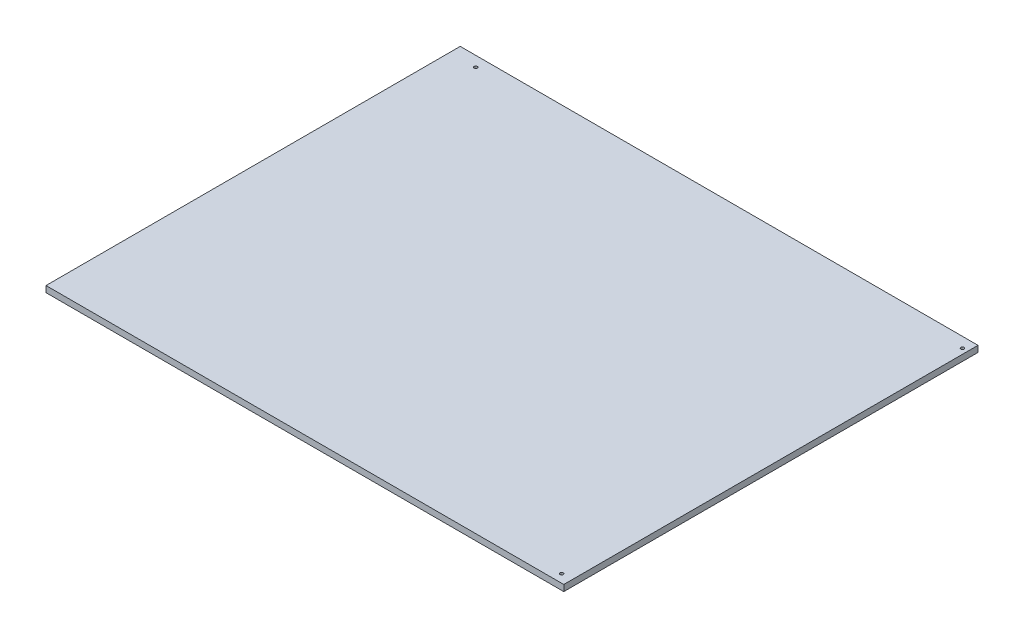
from build123d import *

# Parameters (mm, degrees)
SKETCH1_W           = 500
SKETCH1_H           = 400
SKETCH1_R           = 1.525
SKETCH1_R_2         = 1.5
BOSS_EXTRUDE1_DEPTH = 6


with BuildPart() as part:
    # Sketch1 → Boss-Extrude1 (new body)
    with BuildSketch(Plane(origin=(0, 0, 0), x_dir=(1, 0, 0), z_dir=(0, 1, 0))):
        with Locations((250, -200)):
            Rectangle(SKETCH1_W, SKETCH1_H)
        with Locations((25, -10)):
            Circle(SKETCH1_R, mode=Mode.SUBTRACT)
        with Locations((490, -392)):
            Circle(SKETCH1_R_2, mode=Mode.SUBTRACT)
        with Locations((495, -10)):
            Circle(SKETCH1_R, mode=Mode.SUBTRACT)
    extrude(amount=BOSS_EXTRUDE1_DEPTH)


solid = part.part
